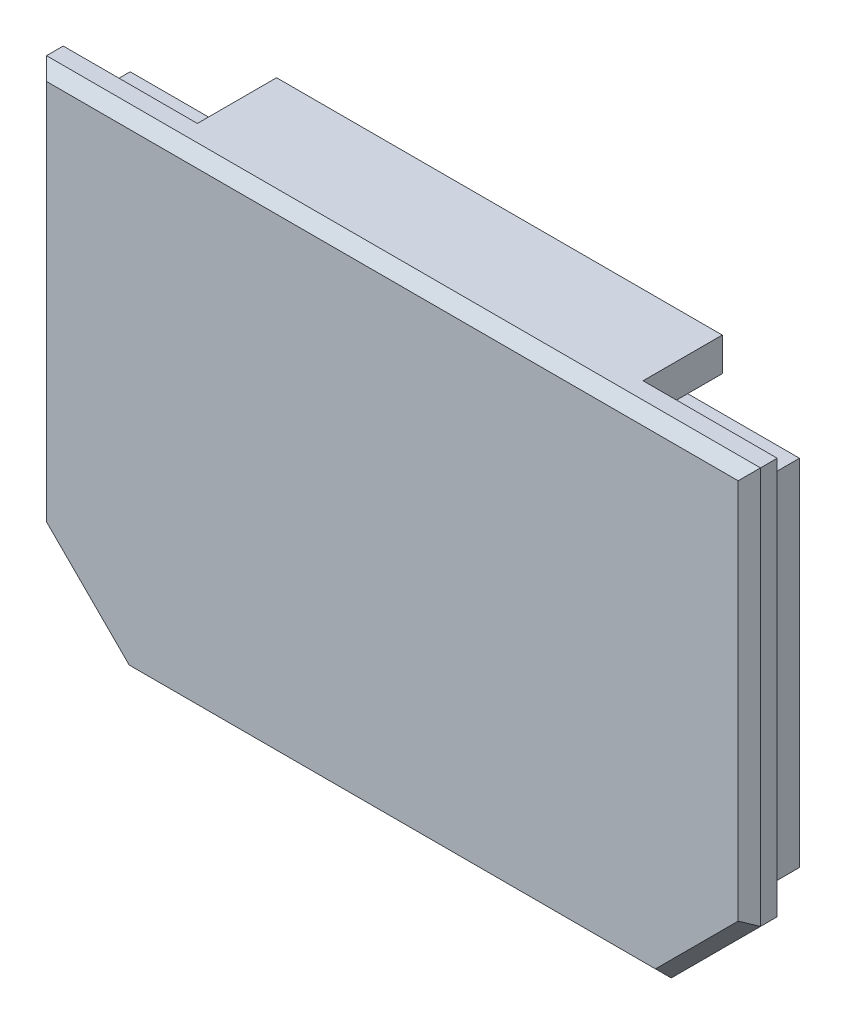
from build123d import *

# Parameters (mm, degrees)
BOSS_EXTRUDE1_DEPTH = 4
BOSS_EXTRUDE2_DEPTH = 2.5
CHAMFER1_SIZE       = 1
SKETCH4_W           = 6
SKETCH4_H           = 1.5
CUT_EXTRUDE1_DEPTH  = 2.0001
CHAMFER2_SIZE       = 1
SKETCH5_W           = 39.95
SKETCH5_H           = 3.0001
BOSS_EXTRUDE3_DEPTH = 7.1


with BuildPart() as part:
    # Sketch2 → Boss-Extrude1 (new body)
    with BuildSketch(Plane.XY):
        Polygon((-29.9999, -3.0001), (29.9999, -3.0001), (29.9999, -34.771531454), (23.171531454, -41.5999), (-23.171531454, -41.5999), (-29.9999, -34.771531454), align=None)
        Polygon((-28, -33.943145751), (-28, -5), (28, -5), (28, -33.943145751), (22.343145751, -39.6), (-22.343145751, -39.6), align=None, mode=Mode.SUBTRACT)
    extrude(amount=-BOSS_EXTRUDE1_DEPTH)

    # Sketch3 → Boss-Extrude2 (add)
    with BuildSketch(Plane.XY):
        Polygon((-32, 0), (32, 0), (32, -35.6), (24, -43.6), (-24, -43.6), (-32, -35.6), align=None)
    extrude(amount=BOSS_EXTRUDE2_DEPTH)

    # Chamfer1
    chamfer1_edges = [part.edges().sort_by_distance(p)[0] for p in [
        (-32, -17.8, 2.5),
        (-28, -39.6, 2.5),
        (0, -43.6, 2.5),
        (28, -39.6, 2.5),
        (32, -17.8, 2.5),
        (0, 0, 2.5),
    ]]
    chamfer(chamfer1_edges, length=CHAMFER1_SIZE)

    # Sketch4 → Cut-Extrude1 (cut)
    with BuildSketch(Plane.XZ.offset(43.6)):
        Rectangle(SKETCH4_W, SKETCH4_H)
    extrude(amount=-CUT_EXTRUDE1_DEPTH, mode=Mode.SUBTRACT)

    # Chamfer2
    # the kernel refuses this chamfer: 1 mm, written as the material it adds along each edge
    with BuildSketch(Plane(origin=(3, -43.6, 0.75), x_dir=(0.027495876610586487, 0, -0.9996219169112968), z_dir=(0, 1, 0))) as chamfer2_piece_1_section:
        Polygon((CHAMFER2_SIZE * 0.999621916911, CHAMFER2_SIZE * 0.0274958766106), (-CHAMFER2_SIZE * 0.0274958766106, CHAMFER2_SIZE * 0.999621916911), (0, 0), align=None)
    chamfer2_piece_1 = extrude(amount=4.571782988, mode=Mode.PRIVATE)
    chamfer2_piece_1 = split(chamfer2_piece_1, bisect_by=Plane(origin=(2.65, -42.59995, 0), z_dir=(0, 0, 1)), keep=Keep.TOP, mode=Mode.PRIVATE)
    add(chamfer2_piece_1)
    with BuildSketch(Plane(origin=(-3, -43.6, 0.75), x_dir=(-0.027495876610586487, 0, -0.9996219169112968), z_dir=(0, 1, 0))) as chamfer2_piece_2_section:
        Polygon((CHAMFER2_SIZE * 0.999621916911, -CHAMFER2_SIZE * 0.0274958766106), (-CHAMFER2_SIZE * 0.0274958766106, -CHAMFER2_SIZE * 0.999621916911), (0, 0), align=None)
    chamfer2_piece_2 = extrude(amount=4.571782988, mode=Mode.PRIVATE)
    chamfer2_piece_2 = split(chamfer2_piece_2, bisect_by=Plane(origin=(-2.65, -42.59995, 0), z_dir=(0, 0, 1)), keep=Keep.TOP, mode=Mode.PRIVATE)
    add(chamfer2_piece_2)

    # Sketch5 → Boss-Extrude3 (add)
    with BuildSketch(Plane(origin=(0, 0, 0), x_dir=(-1, 0, 0), z_dir=(0, 0, -1))):
        with Locations((0, -1.50005)):
            Rectangle(SKETCH5_W, SKETCH5_H)
    extrude(amount=BOSS_EXTRUDE3_DEPTH)


solid = part.part
